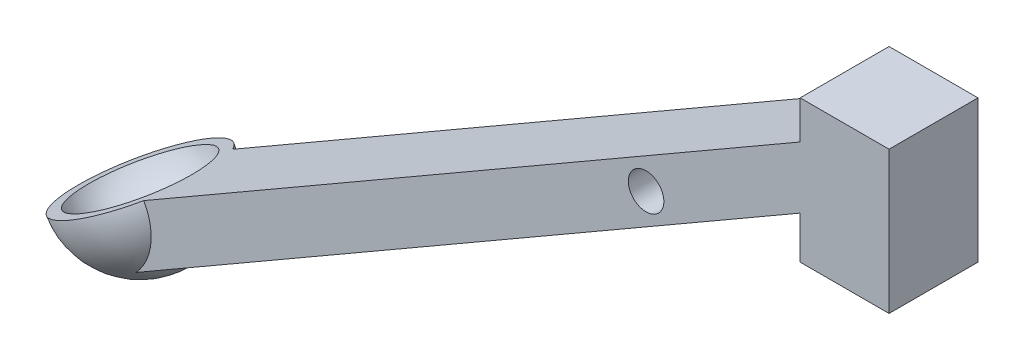
from build123d import *
from build123d.topology import SkipClean

# Parameters (mm, degrees)
BOSS_EXTRUDE1_DEPTH          = 50
CUT_REVOLVE1_ANGLE           = 90
CUT_REVOLVE1_OTHER_WAY_ANGLE = 90
SKETCH5_R                    = 10
CUT_EXTRUDE1_DEPTH           = 524.883590244


# Read off the part's stored shape, not the designer's step: Revolve1
with BuildPart() as part:
    # Sketch1 → Boss-Extrude1 (new body)
    with BuildSketch(Plane.XY):
        Polygon((-25, -16.128), (-406.051177665, -236.128), (-421.051177665, -210.147237886), (-25, 18.513016151), (-25, 40), (25, 40), (25, -40), (-25, -40), align=None)
    extrude(amount=BOSS_EXTRUDE1_DEPTH)

    # Revolve1 outline → Revolve1 (revolve)
    with BuildSketch(Plane(origin=(-406.784806521, -234.857317547, 25), x_dir=(0.8660254037844362, 0.5000000000000042, 0), z_dir=(0, 0, -1))):
        with BuildLine():
            Line((0, 11.467257712), (0, -28.532742288))
            Line((0, -28.532742288), (40, -28.532742288))
            ThreePointArc((40, -28.532742288), (28.284271247, -0.24847104), (0, 11.467257712))
        make_face()
    revolve(axis=Axis((-406.784806521, -234.857317547, 25), (0.5000000000000042, -0.8660254037844362, 0)))

    # Sketch4 → Cut-Revolve1 (revolve, cut)
    with BuildSketch(Plane.XY.offset(25)):
        with BuildLine():
            Line((-395.706087523, -183.967237886), (-456.327865788, -218.967237886))
            ThreePointArc((-456.327865788, -218.967237886), (-408.516976655, -231.778127019), (-395.706087523, -183.967237886))
        make_face()
    revolve(axis=Axis((-395.706087523, -183.967237886, 25), (-0.8660254037844387, -0.49999999999999994, 0)), revolution_arc=CUT_REVOLVE1_ANGLE, mode=Mode.SUBTRACT)

    # Sketch4 → Cut-Revolve1 other way (revolve, cut)
    with SkipClean():  # the faces are left unmerged after this step: merging them gives an invalid solid
        with BuildSketch(Plane.XY.offset(25)):
            with BuildLine():
                Line((-395.706087523, -183.967237886), (-456.327865788, -218.967237886))
                ThreePointArc((-456.327865788, -218.967237886), (-408.516976655, -231.778127019), (-395.706087523, -183.967237886))
            make_face()
        revolve(axis=Axis((-395.706087523, -183.967237886, 25), (0.8660254037844387, 0.49999999999999994, 0)), revolution_arc=CUT_REVOLVE1_OTHER_WAY_ANGLE, mode=Mode.SUBTRACT)

    # Sketch5 → Cut-Extrude1 (cut, through all)
    with SkipClean():  # the faces are left unmerged after this step: merging them gives an invalid solid
        with BuildSketch(Plane.XY.offset(50)):
            with Locations((-111.602540378, -48.807491924)):
                Circle(SKETCH5_R)
        extrude(amount=-CUT_EXTRUDE1_DEPTH, mode=Mode.SUBTRACT)


solid = part.part
